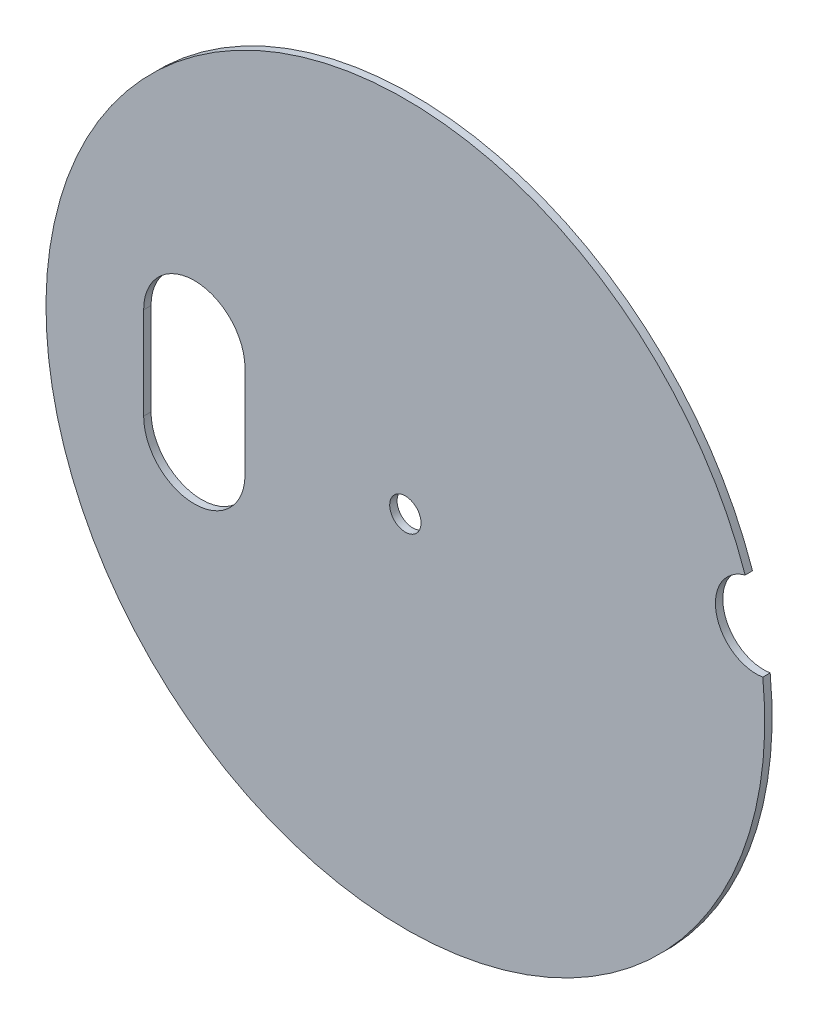
from build123d import *

# Parameters (mm, degrees)
ESQUISSE1_R        = 0.85
BOSS_EXTRU_1_DEPTH = 0.4


with BuildPart() as part:
    # Esquisse1 → Boss.-Extru.1 (new body)
    with BuildSketch(Plane.XY):
        with BuildLine():
            ThreePointArc((18.436174904, 6.352751758), (-19.037772139, -4.220572472), (19.393637784, 2.033915804))
            ThreePointArc((19.393637784, 2.033915804), (16.874861599, 3.741066749), (18.436174904, 6.352751758))
        make_face()
        Circle(ESQUISSE1_R, mode=Mode.SUBTRACT)
        with BuildLine():
            Line((-14.2, -2.5), (-14.2, 2.5))
            ThreePointArc((-14.2, 2.5), (-11.45, 5.25), (-8.7, 2.5))
            Line((-8.7, 2.5), (-8.7, -2.5))
            ThreePointArc((-8.7, -2.5), (-11.45, -5.25), (-14.2, -2.5))
        make_face(mode=Mode.SUBTRACT)
    extrude(amount=BOSS_EXTRU_1_DEPTH)


solid = part.part
